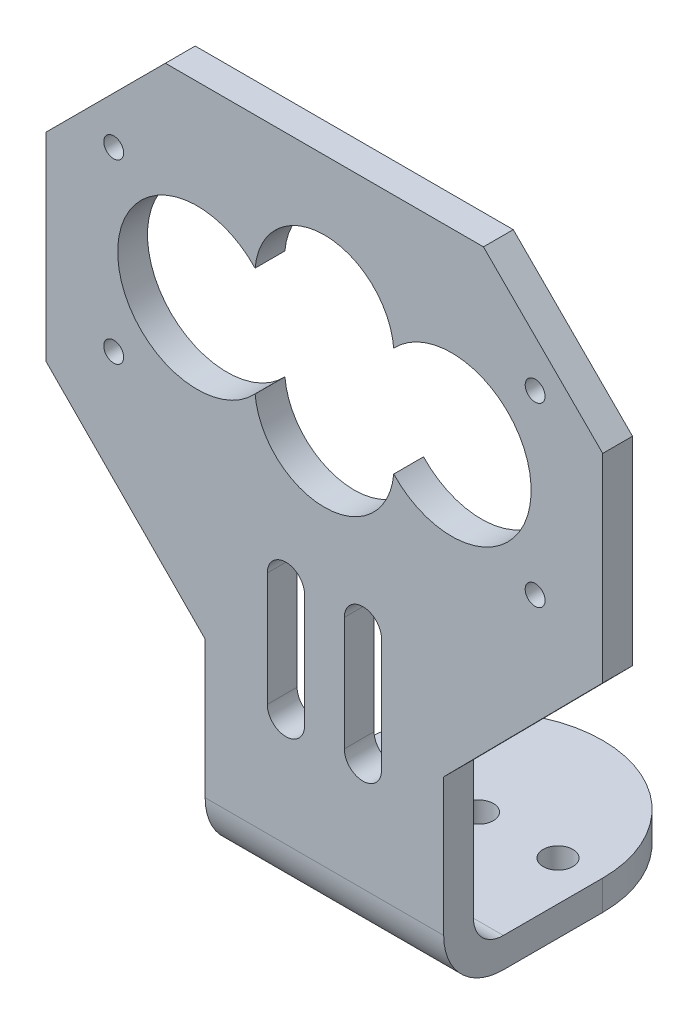
from build123d import *

# Parameters (mm, degrees)
SKETCH1_R           = 1
BOSS_EXTRUDE1_DEPTH = 3
SKETCH2_W           = 24
SKETCH2_H           = 3
BOSS_EXTRUDE2_DEPTH = 25
FILLET3_R           = 12
SKETCH3_R           = 1.5
CUT_EXTRUDE1_DEPTH  = 25
FILLET5_R           = 3
FILLET6_R           = 6


with BuildPart() as part:
    # Sketch1 → Boss-Extrude1 (new body)
    with BuildSketch(Plane.XY):
        Polygon((-5.464285714, 44.366071429), (10.535714286, 60.544642857), (10.535714286, 80.544642857), (-1.464285714, 92.544642857), (-33.464285714, 92.544642857), (-45.464285714, 80.544642857), (-45.464285714, 60.544642857), (-29.464285714, 44.366071429), (-29.464285714, 24.544642857), (-5.464285714, 24.544642857), align=None)
        with BuildLine():
            Line((-23.211141689, 41.803891012), (-23.211141689, 53.258480522))
            ThreePointArc((-23.211141689, 53.258480522), (-21.337713702, 55.131908509), (-19.464285714, 53.258480522))
            Line((-19.464285714, 53.258480522), (-19.464285714, 41.803891012))
            ThreePointArc((-19.464285714, 41.803891012), (-21.337713702, 39.930463025), (-23.211141689, 41.803891012))
        make_face(mode=Mode.SUBTRACT)
        with BuildLine():
            ThreePointArc((-15.464285714, 53.258480522), (-13.590857727, 55.131908509), (-11.71742974, 53.258480522))
            Line((-11.71742974, 53.258480522), (-11.71742974, 41.803891012))
            ThreePointArc((-11.71742974, 41.803891012), (-13.590857727, 39.930463025), (-15.464285714, 41.803891012))
            Line((-15.464285714, 41.803891012), (-15.464285714, 53.258480522))
        make_face(mode=Mode.SUBTRACT)
        with Locations((-38.664285714, 64.817850901)):
            Circle(SKETCH1_R, mode=Mode.SUBTRACT)
        with BuildLine():
            ThreePointArc((-24.437255613, 79.199248551), (-17.464285714, 85.584683016), (-10.491315816, 79.199248551))
            ThreePointArc((-10.491315816, 79.199248551), (3.335714286, 73.717850901), (-10.491315816, 68.236453251))
            ThreePointArc((-10.491315816, 68.236453251), (-17.464285714, 61.851018785), (-24.437255613, 68.236453251))
            ThreePointArc((-24.437255613, 68.236453251), (-38.264285714, 73.717850901), (-24.437255613, 79.199248551))
        make_face(mode=Mode.SUBTRACT)
        with Locations((-38.664285714, 82.617850901)):
            Circle(SKETCH1_R, mode=Mode.SUBTRACT)
        with Locations((3.735714286, 64.817850901)):
            Circle(SKETCH1_R, mode=Mode.SUBTRACT)
        with Locations((3.735714286, 82.617850901)):
            Circle(SKETCH1_R, mode=Mode.SUBTRACT)
    extrude(amount=BOSS_EXTRUDE1_DEPTH)

    # Sketch2 → Boss-Extrude2 (add)
    with BuildSketch(Plane(origin=(0, 0, 0), x_dir=(-1, 0, 0), z_dir=(0, 0, -1))):
        with Locations((17.464285714, 26.044642857)):
            Rectangle(SKETCH2_W, SKETCH2_H)
    extrude(amount=BOSS_EXTRUDE2_DEPTH)

    # Fillet3
    fillet3_edges = [part.edges().sort_by_distance(p)[0] for p in [
        (-29.464285714, 26.044642857, -25),
        (-5.464285714, 26.044642857, -25),
    ]]
    fillet(fillet3_edges, radius=FILLET3_R - 0.0001)  # a hair under: the kernel refuses the full size

    # Sketch3 → Cut-Extrude1 (cut)
    with BuildSketch(Plane(origin=(0, 27.544642857, 0), x_dir=(1, 0, 0), z_dir=(0, 1, 0))):
        with Locations(Location((-17.464285714, 12.5, 0), (0, 0, 270))):
            Circle(SKETCH3_R)
        with Locations(Location((-25.464285714, 12.5, 0), (0, 0, 270))):
            Circle(SKETCH3_R)
        with Locations(Location((-9.464285714, 12.5, 0), (0, 0, 180))):
            Circle(SKETCH3_R)
    extrude(amount=-CUT_EXTRUDE1_DEPTH, mode=Mode.SUBTRACT)

    # Fillet5
    fillet5_edges = [part.edges().sort_by_distance(p)[0] for p in [
        (-17.464285714, 27.544642857, 0),
    ]]
    fillet(fillet5_edges, radius=FILLET5_R)

    # Fillet6
    fillet6_edges = [part.edges().sort_by_distance(p)[0] for p in [
        (-17.464285714, 24.544642857, 3),
    ]]
    fillet(fillet6_edges, radius=FILLET6_R)


solid = part.part
